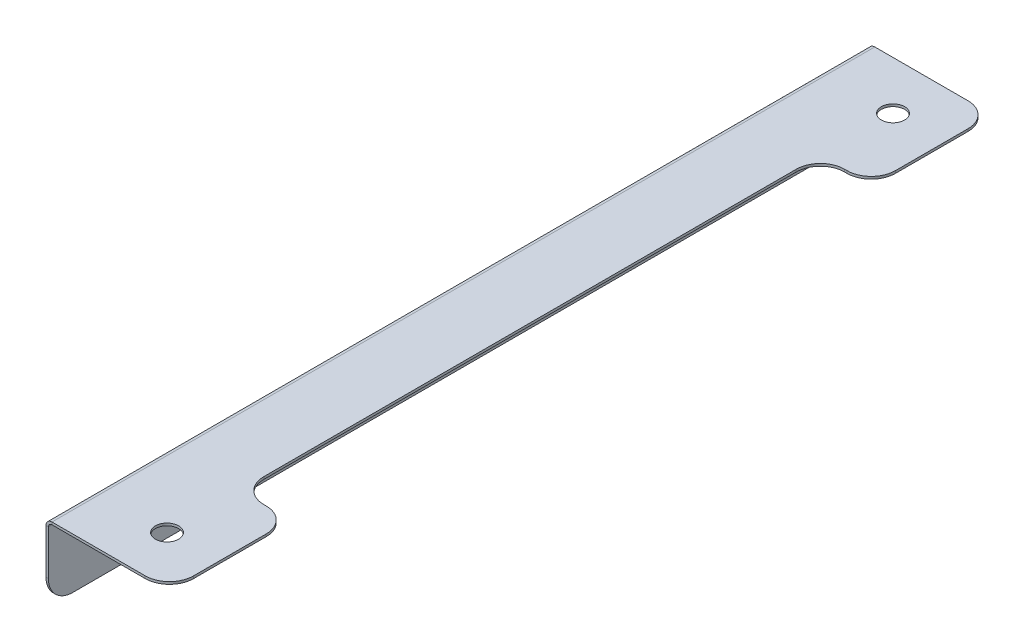
from build123d import *

# Parameters (mm, degrees)
SKETCH2_W                    = 170
SKETCH2_H                    = 15
BASE_FLANGE1_DEPTH           = 0.5
EDGE_FLANGE1_STRIP_W         = 3.4732
EDGE_FLANGE1_STRIP_H         = 0.5
EDGE_FLANGE1_STRIP_CUT_DEPTH = 170
EDGE_FLANGE1_DEPTH           = 170
M4_CLEARANCE_HOLE1_D         = 4.8
SKETCH14_W                   = 10.5
SKETCH14_H                   = 120
CUT_EXTRUDE1_DEPTH           = 90.945817023
BREAK_CORNER1_START          = 7.5
BREAK_CORNER1_DEPTH          = 0.5
BREAK_CORNER1_START_2        = -0.5
BREAK_CORNER1_2_DEPTH        = 0.5
BREAK_CORNER2_START          = 7.5
BREAK_CORNER2_DEPTH          = 0.5
M4_CLEARANCE_HOLE2_D         = 4.8


# Read off the part's stored shape, not the designer's step: Break-Corner1, Break-Corner2
# Sheet-metal steps are written as plain solids
with BuildPart() as part:
    # Sketch2 → Base-Flange1 (new body)
    with BuildSketch(Plane(origin=(0, 0, 0), x_dir=(0, 0, -1), z_dir=(1, 0, 0))):
        Rectangle(SKETCH2_W, SKETCH2_H)
    extrude(amount=-BASE_FLANGE1_DEPTH)

    # Edge-Flange1 strip (across the edge) → Edge-Flange1 strip cut (cut)
    with BuildSketch(Plane(origin=(0, 7.5, -85), x_dir=(0, -1, 0), z_dir=(0, 0, 1))):
        with Locations((-1, -0.25)):
            Rectangle(EDGE_FLANGE1_STRIP_W, EDGE_FLANGE1_STRIP_H)
    extrude(amount=EDGE_FLANGE1_STRIP_CUT_DEPTH, mode=Mode.SUBTRACT)

    # Edge-Flange1 section (across the edge) → Edge-Flange1 (add)
    with BuildSketch(Plane(origin=(0, 7.5, -85), x_dir=(0, -1, 0), z_dir=(0, 0, 1))):
        with BuildLine():
            Line((-0.5, 0.7366), (-0.5, 25))
            Line((-0.5, 25), (0, 25))
            Line((0, 25), (0, 0.7366))
            ThreePointArc((0, 0.7366), (0.215745145, 0.215745145), (0.7366, 0))
            Line((0.7366, 0), (0.7366, -0.5))
            ThreePointArc((0.7366, -0.5), (-0.137808246, -0.137808246), (-0.5, 0.7366))
        make_face()
    extrude(amount=EDGE_FLANGE1_DEPTH)

    # M4 Clearance Hole1 (through all)
    with Locations(Plane(origin=(0, 8, 0), x_dir=(1, 0, 0), z_dir=(0, 1, 0))):
        with Locations((14.5, 75), (14.5, -75)):
            Hole(M4_CLEARANCE_HOLE1_D / 2)

    # Sketch14 → Cut-Extrude1 (cut, through all)
    with BuildSketch(Plane(origin=(0, 8, 0), x_dir=(1, 0, 0), z_dir=(0, 1, 0))):
        with Locations((19.75, 0)):
            Rectangle(SKETCH14_W, SKETCH14_H)
    extrude(amount=-CUT_EXTRUDE1_DEPTH, mode=Mode.SUBTRACT)

    # Break-Corner1 outline → Break-Corner1 (cut)
    with BuildSketch(Plane(origin=(0, 0, 0), x_dir=(1, 0, 0), z_dir=(0, 1, 0)).offset(BREAK_CORNER1_START)):
        with BuildLine():
            Line((25, -85), (25, -80))
            ThreePointArc((25, -80), (23.535533906, -83.535533906), (20, -85))
            Line((20, -85), (25, -85))
        make_face()
        with BuildLine():
            ThreePointArc((20, -60), (23.535533906, -61.464466094), (25, -65))
            Line((25, -65), (25, -60))
            Line((25, -60), (20, -60))
        make_face()
        with BuildLine():
            Line((25, 85), (20, 85))
            ThreePointArc((20, 85), (23.535533906, 83.535533906), (25, 80))
            Line((25, 80), (25, 85))
        make_face()
        with BuildLine():
            Line((25, 60), (25, 65))
            ThreePointArc((25, 65), (23.535533906, 61.464466094), (20, 60))
            Line((20, 60), (25, 60))
        make_face()
    extrude(amount=BREAK_CORNER1_DEPTH, mode=Mode.SUBTRACT)

    # Break-Corner1 2 outline → Break-Corner1 2 (cut)
    with BuildSketch(Plane.YZ.offset(BREAK_CORNER1_START_2)):
        with BuildLine():
            Line((-7.5, 85), (-7.5, 80))
            ThreePointArc((-7.5, 80), (-6.035533906, 83.535533906), (-2.5, 85))
            Line((-2.5, 85), (-7.5, 85))
        make_face()
        with BuildLine():
            ThreePointArc((-2.5, -85), (-6.035533906, -83.535533906), (-7.5, -80))
            Line((-7.5, -80), (-7.5, -85))
            Line((-7.5, -85), (-2.5, -85))
        make_face()
    extrude(amount=BREAK_CORNER1_2_DEPTH, mode=Mode.SUBTRACT)

    # Break-Corner2 outline → Break-Corner2 (add)
    with BuildSketch(Plane(origin=(0, 0, 0), x_dir=(1, 0, 0), z_dir=(0, 1, 0)).offset(BREAK_CORNER2_START)):
        with BuildLine():
            Line((14.5, 60), (14.5, 55))
            ThreePointArc((14.5, 55), (15.964466094, 58.535533906), (19.5, 60))
            Line((19.5, 60), (14.5, 60))
        make_face()
        with BuildLine():
            ThreePointArc((19.5, -60), (15.964466094, -58.535533906), (14.5, -55))
            Line((14.5, -55), (14.5, -60))
            Line((14.5, -60), (19.5, -60))
        make_face()
    extrude(amount=BREAK_CORNER2_DEPTH)

    # M4 Clearance Hole2 (through all)
    with Locations(Plane(origin=(0, 0, 0), x_dir=(0, 0, -1), z_dir=(1, 0, 0))):
        with Locations((-60, 0), (0, 0), (60, 0)):
            Hole(M4_CLEARANCE_HOLE2_D / 2)


solid = part.part
